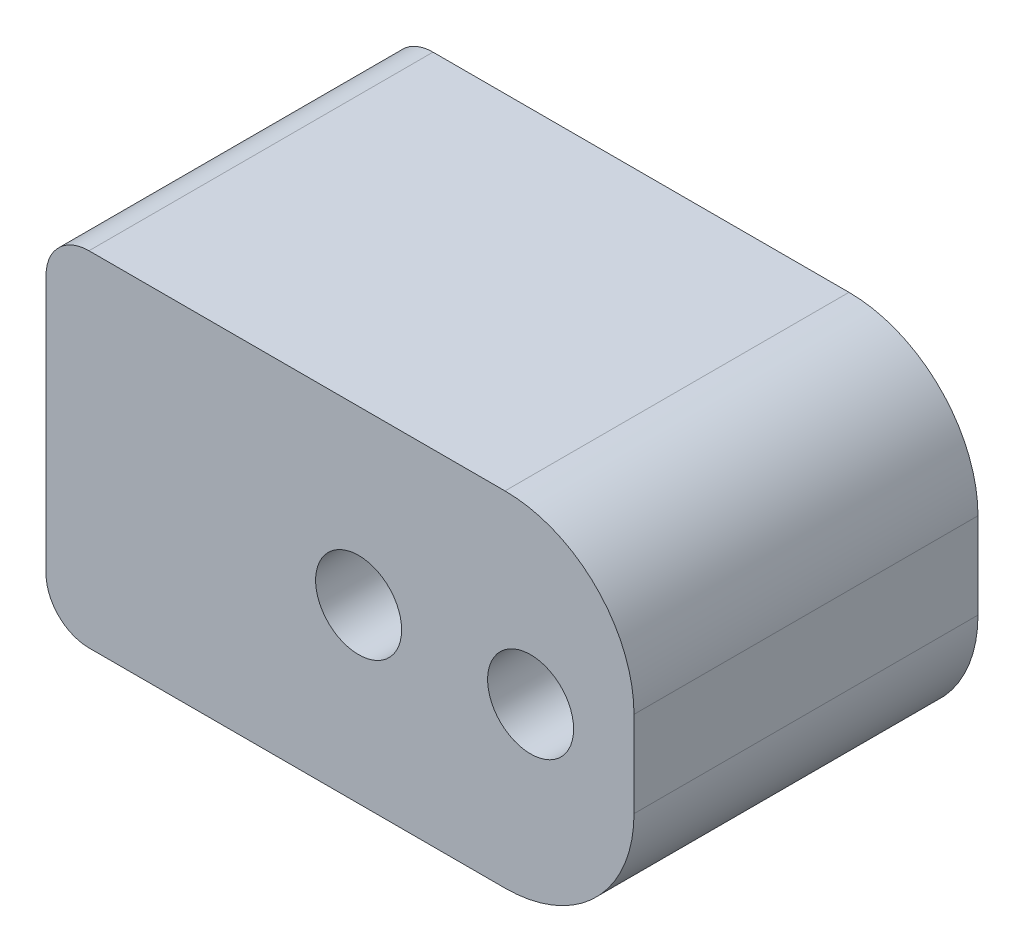
from build123d import *

# Parameters (mm, degrees)
SKETCH1_W           = 13.67451268
SKETCH1_H           = 8
SKETCH1_R           = 1
BOSS_EXTRUDE1_DEPTH = 8
CUT_EXTRUDE3_START  = -0.4
SKETCH4_R           = 3.25
CUT_EXTRUDE3_DEPTH  = 2.7
FILLET2_R           = 1
FILLET3_R           = 3


with BuildPart() as part:
    # Sketch1 → Boss-Extrude1 (new body)
    with BuildSketch(Plane.XY):
        with Locations((-0.43274366, 0)):
            Rectangle(SKETCH1_W, SKETCH1_H)
        Circle(SKETCH1_R, mode=Mode.SUBTRACT)
        with Locations((4, 0)):
            Circle(SKETCH1_R, mode=Mode.SUBTRACT)
    extrude(amount=BOSS_EXTRUDE1_DEPTH)

    # Sketch4 → Cut-Extrude3 (cut)
    with BuildSketch(Plane.ZY.offset(7.27).offset(CUT_EXTRUDE3_START)):
        with Locations((4, 0)):
            Circle(SKETCH4_R)
    extrude(amount=-CUT_EXTRUDE3_DEPTH, mode=Mode.SUBTRACT)

    # Fillet2
    fillet2_edges = [part.edges().sort_by_distance(p)[0] for p in [
        (-7.27, -4, 4),
        (-7.27, 4, 4),
    ]]
    fillet(fillet2_edges, radius=FILLET2_R)

    # Fillet3
    fillet3_edges = [part.edges().sort_by_distance(p)[0] for p in [
        (6.40451268, -4, 4),
        (6.40451268, 4, 4),
    ]]
    fillet(fillet3_edges, radius=FILLET3_R)


solid = part.part
